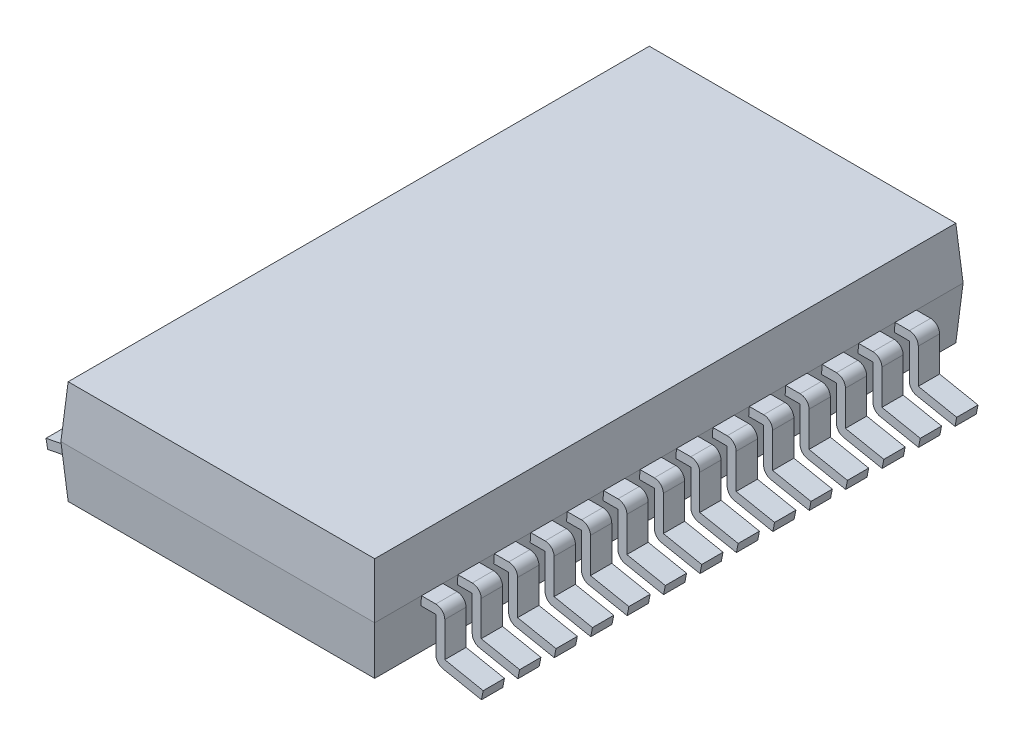
from build123d import *

# Parameters (mm, degrees)
CROQUIS1_W                        = 5.6
CROQUIS1_H                        = 10.5
SALIENTE_EXTRUIR1_DEPTH           = 0.925
SALIENTE_EXTRUIR1_TAPER           = 4
SALIENTE_EXTRUIR1_OTHER_WAY_DEPTH = 0.925
SALIENTE_EXTRUIR1_OTHER_WAY_TAPER = 4
BARRER1_START                     = 0.135
BARRER1_DEPTH                     = 0.38
MATRIZL1_COUNT                    = 7
MATRIZL1_PITCH                    = 0.65
SIMETR_A1_START                   = 0.135
SIMETR_A1_COPY_1_DEPTH            = 0.38
SIMETR_A1_COPY_2_DEPTH            = 0.38
SIMETR_A1_COPY_3_DEPTH            = 0.38
SIMETR_A1_COPY_4_DEPTH            = 0.38
SIMETR_A1_COPY_5_DEPTH            = 0.38
SIMETR_A1_COPY_6_DEPTH            = 0.38
SIMETR_A2_START                   = 0.135
SIMETR_A2_COPY_1_DEPTH            = 0.38
SIMETR_A2_COPY_2_DEPTH            = 0.38
SIMETR_A2_COPY_3_DEPTH            = 0.38
SIMETR_A2_COPY_4_DEPTH            = 0.38
SIMETR_A2_COPY_5_DEPTH            = 0.38
SIMETR_A2_COPY_6_DEPTH            = 0.38
SIMETR_A2_COPY_7_DEPTH            = 0.38
SIMETR_A2_COPY_8_DEPTH            = 0.38
SIMETR_A2_COPY_9_DEPTH            = 0.38
SIMETR_A2_COPY_10_DEPTH           = 0.38
SIMETR_A2_COPY_11_DEPTH           = 0.38
SIMETR_A2_COPY_12_DEPTH           = 0.38
SIMETR_A2_COPY_13_DEPTH           = 0.38


# Read off the part's stored shape, not the designer's step: Barrer1
with BuildPart() as part:
    # Croquis1 → Saliente-Extruir1 (new body)
    with BuildSketch(Plane(origin=(0, 0, 0), x_dir=(1, 0, 0), z_dir=(0, 1, 0))):
        Rectangle(CROQUIS1_W, CROQUIS1_H)
    extrude(amount=SALIENTE_EXTRUIR1_DEPTH, taper=SALIENTE_EXTRUIR1_TAPER)

    # Croquis1 → Saliente-Extruir1 other way (add)
    with BuildSketch(Plane(origin=(0, 0, 0), x_dir=(1, 0, 0), z_dir=(0, 1, 0))):
        Rectangle(CROQUIS1_W, CROQUIS1_H)
    extrude(amount=-SALIENTE_EXTRUIR1_OTHER_WAY_DEPTH, taper=SALIENTE_EXTRUIR1_OTHER_WAY_TAPER)


with BuildPart() as body_2:
    # Barrer1 outline → Barrer1 (new body)
    with BuildSketch(Plane.XY.offset(BARRER1_START)):
        with BuildLine():
            Line((2.78881171, -0.16), (3.055317699, -0.16))
            Line((3.055317699, -0.16), (3.055317699, -0.781308754))
            ThreePointArc((3.055317699, -0.781308754), (3.091717798, -0.882911236), (3.184356005, -0.938284464))
            Line((3.184356005, -0.938284464), (3.869836852, -1.073487855))
            Line((3.869836852, -1.073487855), (3.900798546, -0.916512145))
            Line((3.900798546, -0.916512145), (3.215317699, -0.781308754))
            Line((3.215317699, -0.781308754), (3.215317699, -0.16))
            ThreePointArc((3.215317699, -0.16), (3.168454784, -0.046862915), (3.055317699, 0))
            Line((3.055317699, 0), (2.8, 0))
            Line((2.8, 0), (2.78881171, -0.16))
        make_face()
    barrer1 = extrude(amount=BARRER1_DEPTH)


with BuildPart() as matrizl1_1:
    # MatrizL1: Barrer1 ×7
    with Locations(*[(0, 0, i * MATRIZL1_PITCH) for i in range(1, MATRIZL1_COUNT)]):
        add(barrer1)


with BuildPart() as part_1:
    add(part.part)

    # Simetría1: Barrer1 across plane
    add(barrer1.mirror(Plane(origin=(0, 0, 0), x_dir=(0, 0, 1), z_dir=(1, 0, 0))))

    # Simetría1 copy 1 sketch → Simetría1 copy 1 (add)
    with BuildSketch(Plane(origin=(0, 0, 0.65), x_dir=(-1, 0, 0), z_dir=(0, 0, 1)).offset(SIMETR_A1_START)):
        with BuildLine():
            Line((2.78881171, 0.16), (3.055317699, 0.16))
            Line((3.055317699, 0.16), (3.055317699, 0.781308754))
            ThreePointArc((3.055317699, 0.781308754), (3.091717798, 0.882911236), (3.184356005, 0.938284464))
            Line((3.184356005, 0.938284464), (3.869836852, 1.073487855))
            Line((3.869836852, 1.073487855), (3.900798546, 0.916512145))
            Line((3.900798546, 0.916512145), (3.215317699, 0.781308754))
            Line((3.215317699, 0.781308754), (3.215317699, 0.16))
            ThreePointArc((3.215317699, 0.16), (3.168454784, 0.046862915), (3.055317699, 0))
            Line((3.055317699, 0), (2.8, 0))
            Line((2.8, 0), (2.78881171, 0.16))
        make_face()
    extrude(amount=SIMETR_A1_COPY_1_DEPTH)

    # Simetría1 copy 2 sketch → Simetría1 copy 2 (add)
    with BuildSketch(Plane(origin=(0, 0, 1.3), x_dir=(-1, 0, 0), z_dir=(0, 0, 1)).offset(SIMETR_A1_START)):
        with BuildLine():
            Line((2.78881171, 0.16), (3.055317699, 0.16))
            Line((3.055317699, 0.16), (3.055317699, 0.781308754))
            ThreePointArc((3.055317699, 0.781308754), (3.091717798, 0.882911236), (3.184356005, 0.938284464))
            Line((3.184356005, 0.938284464), (3.869836852, 1.073487855))
            Line((3.869836852, 1.073487855), (3.900798546, 0.916512145))
            Line((3.900798546, 0.916512145), (3.215317699, 0.781308754))
            Line((3.215317699, 0.781308754), (3.215317699, 0.16))
            ThreePointArc((3.215317699, 0.16), (3.168454784, 0.046862915), (3.055317699, 0))
            Line((3.055317699, 0), (2.8, 0))
            Line((2.8, 0), (2.78881171, 0.16))
        make_face()
    extrude(amount=SIMETR_A1_COPY_2_DEPTH)

    # Simetría1 copy 3 sketch → Simetría1 copy 3 (add)
    with BuildSketch(Plane(origin=(0, 0, 1.95), x_dir=(-1, 0, 0), z_dir=(0, 0, 1)).offset(SIMETR_A1_START)):
        with BuildLine():
            Line((2.78881171, 0.16), (3.055317699, 0.16))
            Line((3.055317699, 0.16), (3.055317699, 0.781308754))
            ThreePointArc((3.055317699, 0.781308754), (3.091717798, 0.882911236), (3.184356005, 0.938284464))
            Line((3.184356005, 0.938284464), (3.869836852, 1.073487855))
            Line((3.869836852, 1.073487855), (3.900798546, 0.916512145))
            Line((3.900798546, 0.916512145), (3.215317699, 0.781308754))
            Line((3.215317699, 0.781308754), (3.215317699, 0.16))
            ThreePointArc((3.215317699, 0.16), (3.168454784, 0.046862915), (3.055317699, 0))
            Line((3.055317699, 0), (2.8, 0))
            Line((2.8, 0), (2.78881171, 0.16))
        make_face()
    extrude(amount=SIMETR_A1_COPY_3_DEPTH)

    # Simetría1 copy 4 sketch → Simetría1 copy 4 (add)
    with BuildSketch(Plane(origin=(0, 0, 2.6), x_dir=(-1, 0, 0), z_dir=(0, 0, 1)).offset(SIMETR_A1_START)):
        with BuildLine():
            Line((2.78881171, 0.16), (3.055317699, 0.16))
            Line((3.055317699, 0.16), (3.055317699, 0.781308754))
            ThreePointArc((3.055317699, 0.781308754), (3.091717798, 0.882911236), (3.184356005, 0.938284464))
            Line((3.184356005, 0.938284464), (3.869836852, 1.073487855))
            Line((3.869836852, 1.073487855), (3.900798546, 0.916512145))
            Line((3.900798546, 0.916512145), (3.215317699, 0.781308754))
            Line((3.215317699, 0.781308754), (3.215317699, 0.16))
            ThreePointArc((3.215317699, 0.16), (3.168454784, 0.046862915), (3.055317699, 0))
            Line((3.055317699, 0), (2.8, 0))
            Line((2.8, 0), (2.78881171, 0.16))
        make_face()
    extrude(amount=SIMETR_A1_COPY_4_DEPTH)

    # Simetría1 copy 5 sketch → Simetría1 copy 5 (add)
    with BuildSketch(Plane(origin=(0, 0, 3.25), x_dir=(-1, 0, 0), z_dir=(0, 0, 1)).offset(SIMETR_A1_START)):
        with BuildLine():
            Line((2.78881171, 0.16), (3.055317699, 0.16))
            Line((3.055317699, 0.16), (3.055317699, 0.781308754))
            ThreePointArc((3.055317699, 0.781308754), (3.091717798, 0.882911236), (3.184356005, 0.938284464))
            Line((3.184356005, 0.938284464), (3.869836852, 1.073487855))
            Line((3.869836852, 1.073487855), (3.900798546, 0.916512145))
            Line((3.900798546, 0.916512145), (3.215317699, 0.781308754))
            Line((3.215317699, 0.781308754), (3.215317699, 0.16))
            ThreePointArc((3.215317699, 0.16), (3.168454784, 0.046862915), (3.055317699, 0))
            Line((3.055317699, 0), (2.8, 0))
            Line((2.8, 0), (2.78881171, 0.16))
        make_face()
    extrude(amount=SIMETR_A1_COPY_5_DEPTH)

    # Simetría1 copy 6 sketch → Simetría1 copy 6 (add)
    with BuildSketch(Plane(origin=(0, 0, 3.9), x_dir=(-1, 0, 0), z_dir=(0, 0, 1)).offset(SIMETR_A1_START)):
        with BuildLine():
            Line((2.78881171, 0.16), (3.055317699, 0.16))
            Line((3.055317699, 0.16), (3.055317699, 0.781308754))
            ThreePointArc((3.055317699, 0.781308754), (3.091717798, 0.882911236), (3.184356005, 0.938284464))
            Line((3.184356005, 0.938284464), (3.869836852, 1.073487855))
            Line((3.869836852, 1.073487855), (3.900798546, 0.916512145))
            Line((3.900798546, 0.916512145), (3.215317699, 0.781308754))
            Line((3.215317699, 0.781308754), (3.215317699, 0.16))
            ThreePointArc((3.215317699, 0.16), (3.168454784, 0.046862915), (3.055317699, 0))
            Line((3.055317699, 0), (2.8, 0))
            Line((2.8, 0), (2.78881171, 0.16))
        make_face()
    extrude(amount=SIMETR_A1_COPY_6_DEPTH)

    # Simetría2: Barrer1 across plane
    add(barrer1.mirror(Plane.XY))

    # Simetría2 copy 1 sketch → Simetría2 copy 1 (add)
    with BuildSketch(Plane(origin=(0, 0, -0.65), x_dir=(1, 0, 0), z_dir=(0, 0, -1)).offset(SIMETR_A2_START)):
        with BuildLine():
            Line((2.78881171, 0.16), (3.055317699, 0.16))
            Line((3.055317699, 0.16), (3.055317699, 0.781308754))
            ThreePointArc((3.055317699, 0.781308754), (3.091717798, 0.882911236), (3.184356005, 0.938284464))
            Line((3.184356005, 0.938284464), (3.869836852, 1.073487855))
            Line((3.869836852, 1.073487855), (3.900798546, 0.916512145))
            Line((3.900798546, 0.916512145), (3.215317699, 0.781308754))
            Line((3.215317699, 0.781308754), (3.215317699, 0.16))
            ThreePointArc((3.215317699, 0.16), (3.168454784, 0.046862915), (3.055317699, 0))
            Line((3.055317699, 0), (2.8, 0))
            Line((2.8, 0), (2.78881171, 0.16))
        make_face()
    extrude(amount=SIMETR_A2_COPY_1_DEPTH)

    # Simetría2 copy 2 sketch → Simetría2 copy 2 (add)
    with BuildSketch(Plane(origin=(0, 0, -1.3), x_dir=(1, 0, 0), z_dir=(0, 0, -1)).offset(SIMETR_A2_START)):
        with BuildLine():
            Line((2.78881171, 0.16), (3.055317699, 0.16))
            Line((3.055317699, 0.16), (3.055317699, 0.781308754))
            ThreePointArc((3.055317699, 0.781308754), (3.091717798, 0.882911236), (3.184356005, 0.938284464))
            Line((3.184356005, 0.938284464), (3.869836852, 1.073487855))
            Line((3.869836852, 1.073487855), (3.900798546, 0.916512145))
            Line((3.900798546, 0.916512145), (3.215317699, 0.781308754))
            Line((3.215317699, 0.781308754), (3.215317699, 0.16))
            ThreePointArc((3.215317699, 0.16), (3.168454784, 0.046862915), (3.055317699, 0))
            Line((3.055317699, 0), (2.8, 0))
            Line((2.8, 0), (2.78881171, 0.16))
        make_face()
    extrude(amount=SIMETR_A2_COPY_2_DEPTH)

    # Simetría2 copy 3 sketch → Simetría2 copy 3 (add)
    with BuildSketch(Plane(origin=(0, 0, -1.95), x_dir=(1, 0, 0), z_dir=(0, 0, -1)).offset(SIMETR_A2_START)):
        with BuildLine():
            Line((2.78881171, 0.16), (3.055317699, 0.16))
            Line((3.055317699, 0.16), (3.055317699, 0.781308754))
            ThreePointArc((3.055317699, 0.781308754), (3.091717798, 0.882911236), (3.184356005, 0.938284464))
            Line((3.184356005, 0.938284464), (3.869836852, 1.073487855))
            Line((3.869836852, 1.073487855), (3.900798546, 0.916512145))
            Line((3.900798546, 0.916512145), (3.215317699, 0.781308754))
            Line((3.215317699, 0.781308754), (3.215317699, 0.16))
            ThreePointArc((3.215317699, 0.16), (3.168454784, 0.046862915), (3.055317699, 0))
            Line((3.055317699, 0), (2.8, 0))
            Line((2.8, 0), (2.78881171, 0.16))
        make_face()
    extrude(amount=SIMETR_A2_COPY_3_DEPTH)

    # Simetría2 copy 4 sketch → Simetría2 copy 4 (add)
    with BuildSketch(Plane(origin=(0, 0, -2.6), x_dir=(1, 0, 0), z_dir=(0, 0, -1)).offset(SIMETR_A2_START)):
        with BuildLine():
            Line((2.78881171, 0.16), (3.055317699, 0.16))
            Line((3.055317699, 0.16), (3.055317699, 0.781308754))
            ThreePointArc((3.055317699, 0.781308754), (3.091717798, 0.882911236), (3.184356005, 0.938284464))
            Line((3.184356005, 0.938284464), (3.869836852, 1.073487855))
            Line((3.869836852, 1.073487855), (3.900798546, 0.916512145))
            Line((3.900798546, 0.916512145), (3.215317699, 0.781308754))
            Line((3.215317699, 0.781308754), (3.215317699, 0.16))
            ThreePointArc((3.215317699, 0.16), (3.168454784, 0.046862915), (3.055317699, 0))
            Line((3.055317699, 0), (2.8, 0))
            Line((2.8, 0), (2.78881171, 0.16))
        make_face()
    extrude(amount=SIMETR_A2_COPY_4_DEPTH)

    # Simetría2 copy 5 sketch → Simetría2 copy 5 (add)
    with BuildSketch(Plane(origin=(0, 0, -3.25), x_dir=(1, 0, 0), z_dir=(0, 0, -1)).offset(SIMETR_A2_START)):
        with BuildLine():
            Line((2.78881171, 0.16), (3.055317699, 0.16))
            Line((3.055317699, 0.16), (3.055317699, 0.781308754))
            ThreePointArc((3.055317699, 0.781308754), (3.091717798, 0.882911236), (3.184356005, 0.938284464))
            Line((3.184356005, 0.938284464), (3.869836852, 1.073487855))
            Line((3.869836852, 1.073487855), (3.900798546, 0.916512145))
            Line((3.900798546, 0.916512145), (3.215317699, 0.781308754))
            Line((3.215317699, 0.781308754), (3.215317699, 0.16))
            ThreePointArc((3.215317699, 0.16), (3.168454784, 0.046862915), (3.055317699, 0))
            Line((3.055317699, 0), (2.8, 0))
            Line((2.8, 0), (2.78881171, 0.16))
        make_face()
    extrude(amount=SIMETR_A2_COPY_5_DEPTH)

    # Simetría2 copy 6 sketch → Simetría2 copy 6 (add)
    with BuildSketch(Plane(origin=(0, 0, -3.9), x_dir=(1, 0, 0), z_dir=(0, 0, -1)).offset(SIMETR_A2_START)):
        with BuildLine():
            Line((2.78881171, 0.16), (3.055317699, 0.16))
            Line((3.055317699, 0.16), (3.055317699, 0.781308754))
            ThreePointArc((3.055317699, 0.781308754), (3.091717798, 0.882911236), (3.184356005, 0.938284464))
            Line((3.184356005, 0.938284464), (3.869836852, 1.073487855))
            Line((3.869836852, 1.073487855), (3.900798546, 0.916512145))
            Line((3.900798546, 0.916512145), (3.215317699, 0.781308754))
            Line((3.215317699, 0.781308754), (3.215317699, 0.16))
            ThreePointArc((3.215317699, 0.16), (3.168454784, 0.046862915), (3.055317699, 0))
            Line((3.055317699, 0), (2.8, 0))
            Line((2.8, 0), (2.78881171, 0.16))
        make_face()
    extrude(amount=SIMETR_A2_COPY_6_DEPTH)

    # Simetría2 copy 7 sketch → Simetría2 copy 7 (add)
    with BuildSketch(Plane(origin=(0, 0, 0), x_dir=(-1, 0, 0), z_dir=(0, 0, -1)).offset(SIMETR_A2_START)):
        with BuildLine():
            Line((2.78881171, -0.16), (3.055317699, -0.16))
            Line((3.055317699, -0.16), (3.055317699, -0.781308754))
            ThreePointArc((3.055317699, -0.781308754), (3.091717798, -0.882911236), (3.184356005, -0.938284464))
            Line((3.184356005, -0.938284464), (3.869836852, -1.073487855))
            Line((3.869836852, -1.073487855), (3.900798546, -0.916512145))
            Line((3.900798546, -0.916512145), (3.215317699, -0.781308754))
            Line((3.215317699, -0.781308754), (3.215317699, -0.16))
            ThreePointArc((3.215317699, -0.16), (3.168454784, -0.046862915), (3.055317699, 0))
            Line((3.055317699, 0), (2.8, 0))
            Line((2.8, 0), (2.78881171, -0.16))
        make_face()
    extrude(amount=SIMETR_A2_COPY_7_DEPTH)

    # Simetría2 copy 8 sketch → Simetría2 copy 8 (add)
    with BuildSketch(Plane(origin=(0, 0, -0.65), x_dir=(-1, 0, 0), z_dir=(0, 0, -1)).offset(SIMETR_A2_START)):
        with BuildLine():
            Line((2.78881171, -0.16), (3.055317699, -0.16))
            Line((3.055317699, -0.16), (3.055317699, -0.781308754))
            ThreePointArc((3.055317699, -0.781308754), (3.091717798, -0.882911236), (3.184356005, -0.938284464))
            Line((3.184356005, -0.938284464), (3.869836852, -1.073487855))
            Line((3.869836852, -1.073487855), (3.900798546, -0.916512145))
            Line((3.900798546, -0.916512145), (3.215317699, -0.781308754))
            Line((3.215317699, -0.781308754), (3.215317699, -0.16))
            ThreePointArc((3.215317699, -0.16), (3.168454784, -0.046862915), (3.055317699, 0))
            Line((3.055317699, 0), (2.8, 0))
            Line((2.8, 0), (2.78881171, -0.16))
        make_face()
    extrude(amount=SIMETR_A2_COPY_8_DEPTH)

    # Simetría2 copy 9 sketch → Simetría2 copy 9 (add)
    with BuildSketch(Plane(origin=(0, 0, -1.3), x_dir=(-1, 0, 0), z_dir=(0, 0, -1)).offset(SIMETR_A2_START)):
        with BuildLine():
            Line((2.78881171, -0.16), (3.055317699, -0.16))
            Line((3.055317699, -0.16), (3.055317699, -0.781308754))
            ThreePointArc((3.055317699, -0.781308754), (3.091717798, -0.882911236), (3.184356005, -0.938284464))
            Line((3.184356005, -0.938284464), (3.869836852, -1.073487855))
            Line((3.869836852, -1.073487855), (3.900798546, -0.916512145))
            Line((3.900798546, -0.916512145), (3.215317699, -0.781308754))
            Line((3.215317699, -0.781308754), (3.215317699, -0.16))
            ThreePointArc((3.215317699, -0.16), (3.168454784, -0.046862915), (3.055317699, 0))
            Line((3.055317699, 0), (2.8, 0))
            Line((2.8, 0), (2.78881171, -0.16))
        make_face()
    extrude(amount=SIMETR_A2_COPY_9_DEPTH)

    # Simetría2 copy 10 sketch → Simetría2 copy 10 (add)
    with BuildSketch(Plane(origin=(0, 0, -1.95), x_dir=(-1, 0, 0), z_dir=(0, 0, -1)).offset(SIMETR_A2_START)):
        with BuildLine():
            Line((2.78881171, -0.16), (3.055317699, -0.16))
            Line((3.055317699, -0.16), (3.055317699, -0.781308754))
            ThreePointArc((3.055317699, -0.781308754), (3.091717798, -0.882911236), (3.184356005, -0.938284464))
            Line((3.184356005, -0.938284464), (3.869836852, -1.073487855))
            Line((3.869836852, -1.073487855), (3.900798546, -0.916512145))
            Line((3.900798546, -0.916512145), (3.215317699, -0.781308754))
            Line((3.215317699, -0.781308754), (3.215317699, -0.16))
            ThreePointArc((3.215317699, -0.16), (3.168454784, -0.046862915), (3.055317699, 0))
            Line((3.055317699, 0), (2.8, 0))
            Line((2.8, 0), (2.78881171, -0.16))
        make_face()
    extrude(amount=SIMETR_A2_COPY_10_DEPTH)

    # Simetría2 copy 11 sketch → Simetría2 copy 11 (add)
    with BuildSketch(Plane(origin=(0, 0, -2.6), x_dir=(-1, 0, 0), z_dir=(0, 0, -1)).offset(SIMETR_A2_START)):
        with BuildLine():
            Line((2.78881171, -0.16), (3.055317699, -0.16))
            Line((3.055317699, -0.16), (3.055317699, -0.781308754))
            ThreePointArc((3.055317699, -0.781308754), (3.091717798, -0.882911236), (3.184356005, -0.938284464))
            Line((3.184356005, -0.938284464), (3.869836852, -1.073487855))
            Line((3.869836852, -1.073487855), (3.900798546, -0.916512145))
            Line((3.900798546, -0.916512145), (3.215317699, -0.781308754))
            Line((3.215317699, -0.781308754), (3.215317699, -0.16))
            ThreePointArc((3.215317699, -0.16), (3.168454784, -0.046862915), (3.055317699, 0))
            Line((3.055317699, 0), (2.8, 0))
            Line((2.8, 0), (2.78881171, -0.16))
        make_face()
    extrude(amount=SIMETR_A2_COPY_11_DEPTH)

    # Simetría2 copy 12 sketch → Simetría2 copy 12 (add)
    with BuildSketch(Plane(origin=(0, 0, -3.25), x_dir=(-1, 0, 0), z_dir=(0, 0, -1)).offset(SIMETR_A2_START)):
        with BuildLine():
            Line((2.78881171, -0.16), (3.055317699, -0.16))
            Line((3.055317699, -0.16), (3.055317699, -0.781308754))
            ThreePointArc((3.055317699, -0.781308754), (3.091717798, -0.882911236), (3.184356005, -0.938284464))
            Line((3.184356005, -0.938284464), (3.869836852, -1.073487855))
            Line((3.869836852, -1.073487855), (3.900798546, -0.916512145))
            Line((3.900798546, -0.916512145), (3.215317699, -0.781308754))
            Line((3.215317699, -0.781308754), (3.215317699, -0.16))
            ThreePointArc((3.215317699, -0.16), (3.168454784, -0.046862915), (3.055317699, 0))
            Line((3.055317699, 0), (2.8, 0))
            Line((2.8, 0), (2.78881171, -0.16))
        make_face()
    extrude(amount=SIMETR_A2_COPY_12_DEPTH)

    # Simetría2 copy 13 sketch → Simetría2 copy 13 (add)
    with BuildSketch(Plane(origin=(0, 0, -3.9), x_dir=(-1, 0, 0), z_dir=(0, 0, -1)).offset(SIMETR_A2_START)):
        with BuildLine():
            Line((2.78881171, -0.16), (3.055317699, -0.16))
            Line((3.055317699, -0.16), (3.055317699, -0.781308754))
            ThreePointArc((3.055317699, -0.781308754), (3.091717798, -0.882911236), (3.184356005, -0.938284464))
            Line((3.184356005, -0.938284464), (3.869836852, -1.073487855))
            Line((3.869836852, -1.073487855), (3.900798546, -0.916512145))
            Line((3.900798546, -0.916512145), (3.215317699, -0.781308754))
            Line((3.215317699, -0.781308754), (3.215317699, -0.16))
            ThreePointArc((3.215317699, -0.16), (3.168454784, -0.046862915), (3.055317699, 0))
            Line((3.055317699, 0), (2.8, 0))
            Line((2.8, 0), (2.78881171, -0.16))
        make_face()
    extrude(amount=SIMETR_A2_COPY_13_DEPTH)


solid = Compound([body_2.part, matrizl1_1.part, part_1.part])
